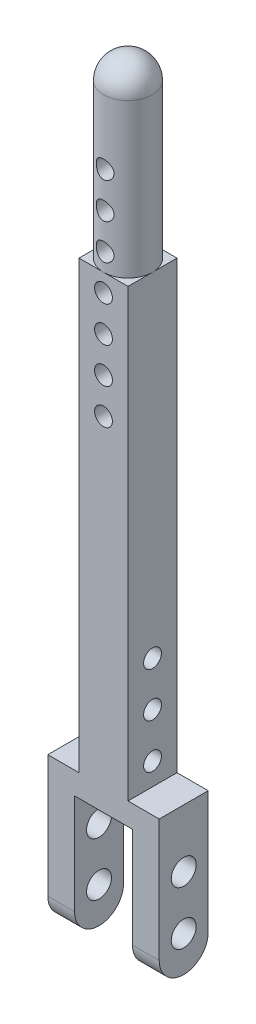
from build123d import *

# Parameters (mm, degrees)
BOSS_EXTRUDE1_DEPTH = 5.5
SKETCH2_R           = 1
CUT_EXTRUDE1_DEPTH  = 5.5
SKETCH3_R           = 1.4
CUT_EXTRUDE2_DEPTH  = 20
SKETCH4_R           = 2.75
BOSS_EXTRUDE2_DEPTH = 20
FILLET1_R           = 2.75
FILLET2_R           = 2.75
SKETCH6_R           = 1
CUT_EXTRUDE4_DEPTH  = 10


with BuildPart() as part:
    # Sketch1 → Boss-Extrude1 (new body)
    with BuildSketch(Plane.XY):
        Polygon((-6.25, -1.20199904), (-6.25, -17.70199904), (-3.25, -17.70199904), (-3.25, -3.70199904), (3.25, -3.70199904), (3.25, -17.70199904), (6.25, -17.70199904), (6.25, -1.20199904), (2.75, -1.20199904), (2.75, 48.79800096), (-2.75, 48.79800096), (-2.75, -1.20199904), align=None)
    extrude(amount=BOSS_EXTRUDE1_DEPTH)

    # Sketch2 → Cut-Extrude1 (cut)
    with BuildSketch(Plane(origin=(2.75, 0, 0), x_dir=(0, 0, -1), z_dir=(1, 0, 0))):
        with Locations((-2.75, 1.29800096)):
            Circle(SKETCH2_R)
        with Locations((-2.75, 6.29800096)):
            Circle(SKETCH2_R)
        with Locations((-2.75, 11.29800096)):
            Circle(SKETCH2_R)
    extrude(amount=-CUT_EXTRUDE1_DEPTH, mode=Mode.SUBTRACT)

    # Sketch3 → Cut-Extrude2 (cut)
    with BuildSketch(Plane(origin=(6.25, 0, 0), x_dir=(0, 0, -1), z_dir=(1, 0, 0))):
        with Locations(Location((-2.75, -7.70199904, 0), (0, 0, 90))):
            Circle(SKETCH3_R)
        with Locations(Location((-2.75, -13.70199904, 0), (0, 0, 90))):
            Circle(SKETCH3_R)
    extrude(amount=-CUT_EXTRUDE2_DEPTH, mode=Mode.SUBTRACT)

    # Sketch4 → Boss-Extrude2 (add)
    with BuildSketch(Plane(origin=(0, 48.79800096, 0), x_dir=(1, 0, 0), z_dir=(0, 1, 0))):
        with Locations(Location((0, -2.75, 0), (0, 0, 270))):
            Circle(SKETCH4_R)
    extrude(amount=BOSS_EXTRUDE2_DEPTH)

    # Fillet1
    fillet1_edges = [part.edges().sort_by_distance(p)[0] for p in [
        (0, 68.79800096, 0),
    ]]
    fillet(fillet1_edges, radius=FILLET1_R)

    # Fillet2
    fillet2_edges = [part.edges().sort_by_distance(p)[0] for p in [
        (4.75, -17.70199904, 5.5),
        (4.75, -17.70199904, 0),
        (-4.75, -17.70199904, 0),
        (-4.75, -17.70199904, 5.5),
    ]]
    fillet(fillet2_edges, radius=FILLET2_R - 0.0001)  # a hair under: the kernel refuses the full size

    # Sketch6 → Cut-Extrude4 (cut)
    with BuildSketch(Plane(origin=(0, 0, 0), x_dir=(-1, 0, 0), z_dir=(0, 0, -1))):
        with Locations((0, 46.79800096)):
            Circle(SKETCH6_R)
        with Locations((0, 42.79800096)):
            Circle(SKETCH6_R)
        with Locations((0, 38.79800096)):
            Circle(SKETCH6_R)
        with Locations((0, 34.79800096)):
            Circle(SKETCH6_R)
        with Locations((0, 50.79800096)):
            Circle(SKETCH6_R)
        with Locations((0, 54.79800096)):
            Circle(SKETCH6_R)
        with Locations((0, 58.79800096)):
            Circle(SKETCH6_R)
    extrude(amount=-CUT_EXTRUDE4_DEPTH, mode=Mode.SUBTRACT)


solid = part.part
